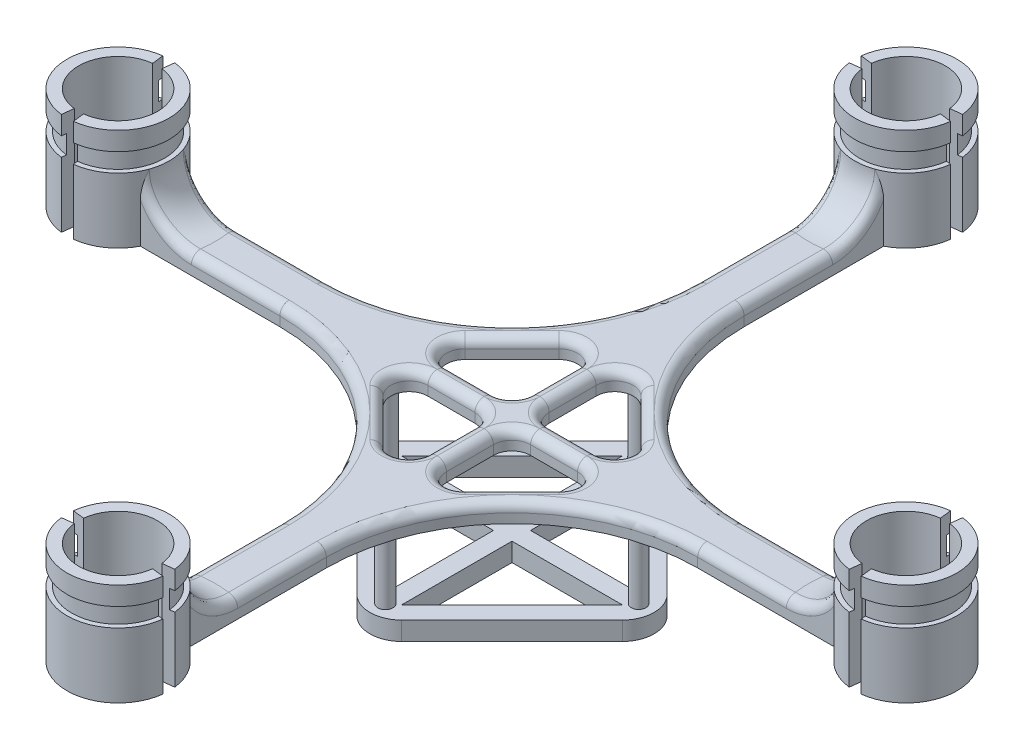
from build123d import *

# Parameters (mm, degrees)
SKETCH1_W           = 5
SKETCH1_H           = 5
BOSS_EXTRUDE1_DEPTH = 2
BOSS_EXTRUDE2_DEPTH = 11
CUT_EXTRUDE1_START  = 7
CUT_EXTRUDE1_DEPTH  = 2
FILLET1_R           = 20
CUT_EXTRUDE2_REACH  = 70.373
FILLET2_R           = 2
FILLET6_R           = 5
FILLET5_R           = 1
SKETCH3_R           = 0.81208947
SKETCH3_R_2         = 1
SKETCH3_R_3         = 0.827650628
SKETCH3_R_4         = 0.78618974
BOSS_EXTRUDE3_DEPTH = 1
SKETCH3_4_R         = 0.78618974
SKETCH3_4_R_2       = 0.827650628
SKETCH3_4_R_3       = 1
SKETCH3_4_R_4       = 0.81208947
BOSS_EXTRUDE4_DEPTH = 10


with BuildPart() as part:
    # Sketch1 → Boss-Extrude1 (new body)
    with BuildSketch(Plane(origin=(0, 0, 0), x_dir=(1, 0, 0), z_dir=(0, 1, 0))):
        with BuildLine():
            ThreePointArc((-4.220485754, 41.926406871), (-3.667100251, 40.278180684), (-2.5, 38.9894751))
            Line((-2.5, 38.9894751), (-2.5, 41.926406871))
            ThreePointArc((-2.5, 41.926406871), (-2.853553391, 42.779960262), (-2, 42.426406871))
            Line((-2, 42.426406871), (2, 42.426406871))
            ThreePointArc((2, 42.426406871), (2.5, 42.926406871), (3, 42.426406871))
            ThreePointArc((3, 42.426406871), (2.853553391, 42.072853481), (2.5, 41.926406871))
            Line((2.5, 41.926406871), (2.5, 38.9894751))
            ThreePointArc((2.5, 38.9894751), (3.667100251, 40.278180684), (4.220485754, 41.926406871))
            ThreePointArc((4.220485754, 41.926406871), (4.242615022, 42.175971705), (4.25, 42.426406871))
            ThreePointArc((4.25, 42.426406871), (4.242615022, 42.676842038), (4.220485754, 42.926406871))
            ThreePointArc((4.220485754, 42.926406871), (0, 46.676406871), (-4.220485754, 42.926406871))
            ThreePointArc((-4.220485754, 42.926406871), (-4.25, 42.426406871), (-4.220485754, 41.926406871))
        make_face()
        with BuildLine():
            Line((-2.5, 41.926406871), (-2.5, 38.9894751))
            ThreePointArc((-2.5, 38.9894751), (0, 38.176406871), (2.5, 38.9894751))
            Line((2.5, 38.9894751), (2.5, 41.926406871))
            ThreePointArc((2.5, 41.926406871), (2.146446609, 42.072853481), (2, 42.426406871))
            Line((2, 42.426406871), (-2, 42.426406871))
            ThreePointArc((-2, 42.426406871), (-2.146446609, 42.072853481), (-2.5, 41.926406871))
        make_face()
        with BuildLine():
            ThreePointArc((4.965277358, 43.014642165), (0, 47.426406871), (-4.965277358, 43.014642165))
            Line((-4.965277358, 43.014642165), (-4.220485754, 42.926406871))
            ThreePointArc((-4.220485754, 42.926406871), (0, 46.676406871), (4.220485754, 42.926406871))
            Line((4.220485754, 42.926406871), (4.965277358, 43.014642165))
        make_face()
        with BuildLine():
            ThreePointArc((5.461805093, 43.073465695), (0, 47.926406871), (-5.461805093, 43.073465695))
            Line((-5.461805093, 43.073465695), (-4.965277358, 43.014642165))
            ThreePointArc((-4.965277358, 43.014642165), (0, 47.426406871), (4.965277358, 43.014642165))
            Line((4.965277358, 43.014642165), (5.461805093, 43.073465695))
        make_face()
        with BuildLine():
            ThreePointArc((-4.965277358, 41.838171577), (-4.175288005, 39.675594251), (-2.5, 38.096279852))
            Line((-2.5, 38.096279852), (-2.5, 38.9894751))
            ThreePointArc((-2.5, 38.9894751), (-3.667100251, 40.278180684), (-4.220485754, 41.926406871))
            Line((-4.220485754, 41.926406871), (-4.965277358, 41.838171577))
        make_face()
        with BuildLine():
            ThreePointArc((-5.461805093, 41.779348048), (-4.513013673, 39.282729473), (-2.5, 37.527427386))
            Line((-2.5, 37.527427386), (-2.5, 38.096279852))
            ThreePointArc((-2.5, 38.096279852), (-4.175288005, 39.675594251), (-4.965277358, 41.838171577))
            Line((-4.965277358, 41.838171577), (-5.461805093, 41.779348048))
        make_face()
        with BuildLine():
            Line((-2.5, 38.9894751), (-2.5, 38.096279852))
            ThreePointArc((-2.5, 38.096279852), (0, 37.426406871), (2.5, 38.096279852))
            Line((2.5, 38.096279852), (2.5, 38.9894751))
            ThreePointArc((2.5, 38.9894751), (0, 38.176406871), (-2.5, 38.9894751))
        make_face()
        with BuildLine():
            Line((-2.5, 37.527427386), (-2.5, 2.5))
            Line((-2.5, 2.5), (2.5, 2.5))
            Line((2.5, 2.5), (2.5, 37.527427386))
            ThreePointArc((2.5, 37.527427386), (0, 36.926406871), (-2.5, 37.527427386))
        make_face()
        with BuildLine():
            Line((2.5, 38.9894751), (2.5, 38.096279852))
            ThreePointArc((2.5, 38.096279852), (4.175288005, 39.675594251), (4.965277358, 41.838171577))
            Line((4.965277358, 41.838171577), (4.220485754, 41.926406871))
            ThreePointArc((4.220485754, 41.926406871), (3.667100251, 40.278180684), (2.5, 38.9894751))
        make_face()
        with BuildLine():
            Line((2.5, 38.096279852), (2.5, 37.527427386))
            ThreePointArc((2.5, 37.527427386), (4.513013673, 39.282729473), (5.461805093, 41.779348048))
            Line((5.461805093, 41.779348048), (4.965277358, 41.838171577))
            ThreePointArc((4.965277358, 41.838171577), (4.175288005, 39.675594251), (2.5, 38.096279852))
        make_face()
        with BuildLine():
            Line((-2.5, 38.096279852), (-2.5, 37.527427386))
            ThreePointArc((-2.5, 37.527427386), (0, 36.926406871), (2.5, 37.527427386))
            Line((2.5, 37.527427386), (2.5, 38.096279852))
            ThreePointArc((2.5, 38.096279852), (0, 37.426406871), (-2.5, 38.096279852))
        make_face()
        with BuildLine():
            Line((2.5, 2.5), (2.5, -2.5))
            Line((2.5, -2.5), (37.527427386, -2.5))
            ThreePointArc((37.527427386, -2.5), (36.926406871, 0), (37.527427386, 2.5))
            Line((37.527427386, 2.5), (2.5, 2.5))
        make_face()
        with BuildLine():
            ThreePointArc((38.9894751, 2.5), (38.176406871, 0), (38.9894751, -2.5))
            Line((38.9894751, -2.5), (41.926406871, -2.5))
            ThreePointArc((41.926406871, -2.5), (42.072853481, -2.146446609), (42.426406871, -2))
            Line((42.426406871, -2), (42.426406871, 2))
            ThreePointArc((42.426406871, 2), (42.072853481, 2.146446609), (41.926406871, 2.5))
            Line((41.926406871, 2.5), (38.9894751, 2.5))
        make_face()
        with BuildLine():
            Line((41.926406871, -2.5), (38.9894751, -2.5))
            ThreePointArc((38.9894751, -2.5), (40.278180684, -3.667100251), (41.926406871, -4.220485754))
            ThreePointArc((41.926406871, -4.220485754), (42.426406871, -4.25), (42.926406871, -4.220485754))
            ThreePointArc((42.926406871, -4.220485754), (45.603473128, -2.822897448), (46.676406871, 0))
            ThreePointArc((46.676406871, 0), (45.603473128, 2.822897448), (42.926406871, 4.220485754))
            ThreePointArc((42.926406871, 4.220485754), (42.426406871, 4.25), (41.926406871, 4.220485754))
            ThreePointArc((41.926406871, 4.220485754), (40.278180684, 3.667100251), (38.9894751, 2.5))
            Line((38.9894751, 2.5), (41.926406871, 2.5))
            ThreePointArc((41.926406871, 2.5), (42.426406871, 3), (42.926406871, 2.5))
            ThreePointArc((42.926406871, 2.5), (42.779960262, 2.146446609), (42.426406871, 2))
            Line((42.426406871, 2), (42.426406871, -2))
            ThreePointArc((42.426406871, -2), (42.779960262, -2.146446609), (42.926406871, -2.5))
            ThreePointArc((42.926406871, -2.5), (42.426406871, -3), (41.926406871, -2.5))
        make_face()
        with BuildLine():
            Line((42.926406871, -4.220485754), (43.014642165, -4.965277358))
            ThreePointArc((43.014642165, -4.965277358), (46.164131879, -3.321055821), (47.426406871, 0))
            ThreePointArc((47.426406871, 0), (46.164131879, 3.321055821), (43.014642165, 4.965277358))
            Line((43.014642165, 4.965277358), (42.926406871, 4.220485754))
            ThreePointArc((42.926406871, 4.220485754), (45.603473128, 2.822897448), (46.676406871, 0))
            ThreePointArc((46.676406871, 0), (45.603473128, -2.822897448), (42.926406871, -4.220485754))
        make_face()
        with BuildLine():
            Line((43.014642165, -4.965277358), (43.073465695, -5.461805093))
            ThreePointArc((43.073465695, -5.461805093), (46.53790438, -3.653161403), (47.926406871, 0))
            ThreePointArc((47.926406871, 0), (46.53790438, 3.653161403), (43.073465695, 5.461805093))
            Line((43.073465695, 5.461805093), (43.014642165, 4.965277358))
            ThreePointArc((43.014642165, 4.965277358), (46.164131879, 3.321055821), (47.426406871, 0))
            ThreePointArc((47.426406871, 0), (46.164131879, -3.321055821), (43.014642165, -4.965277358))
        make_face()
        with BuildLine():
            Line((38.9894751, -2.5), (38.096279852, -2.5))
            ThreePointArc((38.096279852, -2.5), (39.675594251, -4.175288005), (41.838171577, -4.965277358))
            Line((41.838171577, -4.965277358), (41.926406871, -4.220485754))
            ThreePointArc((41.926406871, -4.220485754), (40.278180684, -3.667100251), (38.9894751, -2.5))
        make_face()
        with BuildLine():
            Line((38.096279852, -2.5), (37.527427386, -2.5))
            ThreePointArc((37.527427386, -2.5), (39.282729473, -4.513013673), (41.779348048, -5.461805093))
            Line((41.779348048, -5.461805093), (41.838171577, -4.965277358))
            ThreePointArc((41.838171577, -4.965277358), (39.675594251, -4.175288005), (38.096279852, -2.5))
        make_face()
        with BuildLine():
            ThreePointArc((38.096279852, 2.5), (37.426406871, 0), (38.096279852, -2.5))
            Line((38.096279852, -2.5), (38.9894751, -2.5))
            ThreePointArc((38.9894751, -2.5), (38.176406871, 0), (38.9894751, 2.5))
            Line((38.9894751, 2.5), (38.096279852, 2.5))
        make_face()
        with BuildLine():
            ThreePointArc((37.527427386, 2.5), (36.926406871, 0), (37.527427386, -2.5))
            Line((37.527427386, -2.5), (38.096279852, -2.5))
            ThreePointArc((38.096279852, -2.5), (37.426406871, 0), (38.096279852, 2.5))
            Line((38.096279852, 2.5), (37.527427386, 2.5))
        make_face()
        with BuildLine():
            ThreePointArc((41.838171577, 4.965277358), (39.675594251, 4.175288005), (38.096279852, 2.5))
            Line((38.096279852, 2.5), (38.9894751, 2.5))
            ThreePointArc((38.9894751, 2.5), (40.278180684, 3.667100251), (41.926406871, 4.220485754))
            Line((41.926406871, 4.220485754), (41.838171577, 4.965277358))
        make_face()
        with BuildLine():
            ThreePointArc((41.779348048, 5.461805093), (39.282729473, 4.513013673), (37.527427386, 2.5))
            Line((37.527427386, 2.5), (38.096279852, 2.5))
            ThreePointArc((38.096279852, 2.5), (39.675594251, 4.175288005), (41.838171577, 4.965277358))
            Line((41.838171577, 4.965277358), (41.779348048, 5.461805093))
        make_face()
        with BuildLine():
            Line((2.5, -2.5), (-2.5, -2.5))
            Line((-2.5, -2.5), (-2.5, -37.527427386))
            ThreePointArc((-2.5, -37.527427386), (0, -36.926406871), (2.5, -37.527427386))
            Line((2.5, -37.527427386), (2.5, -2.5))
        make_face()
        with BuildLine():
            ThreePointArc((2.5, -38.9894751), (0, -38.176406871), (-2.5, -38.9894751))
            Line((-2.5, -38.9894751), (-2.5, -41.926406871))
            ThreePointArc((-2.5, -41.926406871), (-2.146446609, -42.072853481), (-2, -42.426406871))
            Line((-2, -42.426406871), (2, -42.426406871))
            ThreePointArc((2, -42.426406871), (2.146446609, -42.072853481), (2.5, -41.926406871))
            Line((2.5, -41.926406871), (2.5, -38.9894751))
        make_face()
        with BuildLine():
            Line((-2.5, -41.926406871), (-2.5, -38.9894751))
            ThreePointArc((-2.5, -38.9894751), (-3.667100251, -40.278180684), (-4.220485754, -41.926406871))
            ThreePointArc((-4.220485754, -41.926406871), (-4.25, -42.426406871), (-4.220485754, -42.926406871))
            ThreePointArc((-4.220485754, -42.926406871), (0, -46.676406871), (4.220485754, -42.926406871))
            ThreePointArc((4.220485754, -42.926406871), (4.242615022, -42.676842038), (4.25, -42.426406871))
            ThreePointArc((4.25, -42.426406871), (4.242615022, -42.175971705), (4.220485754, -41.926406871))
            ThreePointArc((4.220485754, -41.926406871), (3.667100251, -40.278180684), (2.5, -38.9894751))
            Line((2.5, -38.9894751), (2.5, -41.926406871))
            ThreePointArc((2.5, -41.926406871), (2.853553391, -42.072853481), (3, -42.426406871))
            ThreePointArc((3, -42.426406871), (2.5, -42.926406871), (2, -42.426406871))
            Line((2, -42.426406871), (-2, -42.426406871))
            ThreePointArc((-2, -42.426406871), (-2.853553391, -42.779960262), (-2.5, -41.926406871))
        make_face()
        with BuildLine():
            Line((-4.220485754, -42.926406871), (-4.965277358, -43.014642165))
            ThreePointArc((-4.965277358, -43.014642165), (0, -47.426406871), (4.965277358, -43.014642165))
            Line((4.965277358, -43.014642165), (4.220485754, -42.926406871))
            ThreePointArc((4.220485754, -42.926406871), (0, -46.676406871), (-4.220485754, -42.926406871))
        make_face()
        with BuildLine():
            Line((-4.965277358, -43.014642165), (-5.461805093, -43.073465695))
            ThreePointArc((-5.461805093, -43.073465695), (0, -47.926406871), (5.461805093, -43.073465695))
            Line((5.461805093, -43.073465695), (4.965277358, -43.014642165))
            ThreePointArc((4.965277358, -43.014642165), (0, -47.426406871), (-4.965277358, -43.014642165))
        make_face()
        with BuildLine():
            Line((-2.5, -38.9894751), (-2.5, -38.096279852))
            ThreePointArc((-2.5, -38.096279852), (-4.175288005, -39.675594251), (-4.965277358, -41.838171577))
            Line((-4.965277358, -41.838171577), (-4.220485754, -41.926406871))
            ThreePointArc((-4.220485754, -41.926406871), (-3.667100251, -40.278180684), (-2.5, -38.9894751))
        make_face()
        with BuildLine():
            Line((-2.5, -38.096279852), (-2.5, -37.527427386))
            ThreePointArc((-2.5, -37.527427386), (-4.513013673, -39.282729473), (-5.461805093, -41.779348048))
            Line((-5.461805093, -41.779348048), (-4.965277358, -41.838171577))
            ThreePointArc((-4.965277358, -41.838171577), (-4.175288005, -39.675594251), (-2.5, -38.096279852))
        make_face()
        with BuildLine():
            ThreePointArc((2.5, -38.096279852), (0, -37.426406871), (-2.5, -38.096279852))
            Line((-2.5, -38.096279852), (-2.5, -38.9894751))
            ThreePointArc((-2.5, -38.9894751), (0, -38.176406871), (2.5, -38.9894751))
            Line((2.5, -38.9894751), (2.5, -38.096279852))
        make_face()
        with BuildLine():
            ThreePointArc((4.965277358, -41.838171577), (4.175288005, -39.675594251), (2.5, -38.096279852))
            Line((2.5, -38.096279852), (2.5, -38.9894751))
            ThreePointArc((2.5, -38.9894751), (3.667100251, -40.278180684), (4.220485754, -41.926406871))
            Line((4.220485754, -41.926406871), (4.965277358, -41.838171577))
        make_face()
        with BuildLine():
            ThreePointArc((5.461805093, -41.779348048), (4.513013673, -39.282729473), (2.5, -37.527427386))
            Line((2.5, -37.527427386), (2.5, -38.096279852))
            ThreePointArc((2.5, -38.096279852), (4.175288005, -39.675594251), (4.965277358, -41.838171577))
            Line((4.965277358, -41.838171577), (5.461805093, -41.779348048))
        make_face()
        with BuildLine():
            ThreePointArc((2.5, -37.527427386), (0, -36.926406871), (-2.5, -37.527427386))
            Line((-2.5, -37.527427386), (-2.5, -38.096279852))
            ThreePointArc((-2.5, -38.096279852), (0, -37.426406871), (2.5, -38.096279852))
            Line((2.5, -38.096279852), (2.5, -37.527427386))
        make_face()
        with BuildLine():
            ThreePointArc((-36.926406871, 0), (-37.07877248, -1.285615189), (-37.527427386, -2.5))
            Line((-37.527427386, -2.5), (-2.5, -2.5))
            Line((-2.5, -2.5), (-2.5, 2.5))
            Line((-2.5, 2.5), (-37.527427386, 2.5))
            ThreePointArc((-37.527427386, 2.5), (-37.07877248, 1.285615189), (-36.926406871, 0))
        make_face()
        with BuildLine():
            ThreePointArc((-42.926406871, 4.220485754), (-46.676406871, 0), (-42.926406871, -4.220485754))
            ThreePointArc((-42.926406871, -4.220485754), (-42.426406871, -4.25), (-41.926406871, -4.220485754))
            ThreePointArc((-41.926406871, -4.220485754), (-40.278180684, -3.667100251), (-38.9894751, -2.5))
            Line((-38.9894751, -2.5), (-41.926406871, -2.5))
            ThreePointArc((-41.926406871, -2.5), (-42.779960262, -2.853553391), (-42.426406871, -2))
            Line((-42.426406871, -2), (-42.426406871, 2))
            ThreePointArc((-42.426406871, 2), (-42.779960262, 2.853553391), (-41.926406871, 2.5))
            Line((-41.926406871, 2.5), (-38.9894751, 2.5))
            ThreePointArc((-38.9894751, 2.5), (-40.278180684, 3.667100251), (-41.926406871, 4.220485754))
            ThreePointArc((-41.926406871, 4.220485754), (-42.426406871, 4.25), (-42.926406871, 4.220485754))
        make_face()
        with BuildLine():
            Line((-41.926406871, -2.5), (-38.9894751, -2.5))
            ThreePointArc((-38.9894751, -2.5), (-38.384782196, -1.314446646), (-38.176406871, 0))
            ThreePointArc((-38.176406871, 0), (-38.384782196, 1.314446646), (-38.9894751, 2.5))
            Line((-38.9894751, 2.5), (-41.926406871, 2.5))
            ThreePointArc((-41.926406871, 2.5), (-42.072853481, 2.146446609), (-42.426406871, 2))
            Line((-42.426406871, 2), (-42.426406871, -2))
            ThreePointArc((-42.426406871, -2), (-42.072853481, -2.146446609), (-41.926406871, -2.5))
        make_face()
        with BuildLine():
            Line((-43.014642165, -4.965277358), (-42.926406871, -4.220485754))
            ThreePointArc((-42.926406871, -4.220485754), (-46.676406871, 0), (-42.926406871, 4.220485754))
            Line((-42.926406871, 4.220485754), (-43.014642165, 4.965277358))
            ThreePointArc((-43.014642165, 4.965277358), (-47.426406871, 0), (-43.014642165, -4.965277358))
        make_face()
        with BuildLine():
            Line((-43.073465695, -5.461805093), (-43.014642165, -4.965277358))
            ThreePointArc((-43.014642165, -4.965277358), (-47.426406871, 0), (-43.014642165, 4.965277358))
            Line((-43.014642165, 4.965277358), (-43.073465695, 5.461805093))
            ThreePointArc((-43.073465695, 5.461805093), (-47.926406871, 0), (-43.073465695, -5.461805093))
        make_face()
        with BuildLine():
            Line((-41.838171577, 4.965277358), (-41.926406871, 4.220485754))
            ThreePointArc((-41.926406871, 4.220485754), (-40.278180684, 3.667100251), (-38.9894751, 2.5))
            Line((-38.9894751, 2.5), (-38.096279852, 2.5))
            ThreePointArc((-38.096279852, 2.5), (-39.675594251, 4.175288005), (-41.838171577, 4.965277358))
        make_face()
        with BuildLine():
            Line((-41.779348048, 5.461805093), (-41.838171577, 4.965277358))
            ThreePointArc((-41.838171577, 4.965277358), (-39.675594251, 4.175288005), (-38.096279852, 2.5))
            Line((-38.096279852, 2.5), (-37.527427386, 2.5))
            ThreePointArc((-37.527427386, 2.5), (-39.282729473, 4.513013673), (-41.779348048, 5.461805093))
        make_face()
        with BuildLine():
            ThreePointArc((-37.426406871, 0), (-37.59677774, -1.294095226), (-38.096279852, -2.5))
            Line((-38.096279852, -2.5), (-37.527427386, -2.5))
            ThreePointArc((-37.527427386, -2.5), (-37.07877248, -1.285615189), (-36.926406871, 0))
            ThreePointArc((-36.926406871, 0), (-37.07877248, 1.285615189), (-37.527427386, 2.5))
            Line((-37.527427386, 2.5), (-38.096279852, 2.5))
            ThreePointArc((-38.096279852, 2.5), (-37.59677774, 1.294095226), (-37.426406871, 0))
        make_face()
        with BuildLine():
            ThreePointArc((-38.096279852, -2.5), (-39.675594251, -4.175288005), (-41.838171577, -4.965277358))
            Line((-41.838171577, -4.965277358), (-41.779348048, -5.461805093))
            ThreePointArc((-41.779348048, -5.461805093), (-39.282729473, -4.513013673), (-37.527427386, -2.5))
            Line((-37.527427386, -2.5), (-38.096279852, -2.5))
        make_face()
        with BuildLine():
            ThreePointArc((-38.9894751, -2.5), (-40.278180684, -3.667100251), (-41.926406871, -4.220485754))
            Line((-41.926406871, -4.220485754), (-41.838171577, -4.965277358))
            ThreePointArc((-41.838171577, -4.965277358), (-39.675594251, -4.175288005), (-38.096279852, -2.5))
            Line((-38.096279852, -2.5), (-38.9894751, -2.5))
        make_face()
        with BuildLine():
            ThreePointArc((-38.176406871, 0), (-38.384782196, -1.314446646), (-38.9894751, -2.5))
            Line((-38.9894751, -2.5), (-38.096279852, -2.5))
            ThreePointArc((-38.096279852, -2.5), (-37.59677774, -1.294095226), (-37.426406871, 0))
            ThreePointArc((-37.426406871, 0), (-37.59677774, 1.294095226), (-38.096279852, 2.5))
            Line((-38.096279852, 2.5), (-38.9894751, 2.5))
            ThreePointArc((-38.9894751, 2.5), (-38.384782196, 1.314446646), (-38.176406871, 0))
        make_face()
        Rectangle(SKETCH1_W, SKETCH1_H)
    extrude(amount=BOSS_EXTRUDE1_DEPTH)

    # Sketch1<4> → Boss-Extrude2 (add)
    with BuildSketch(Plane(origin=(0, 0, 0), x_dir=(1, 0, 0), z_dir=(0, 1, 0))):
        with BuildLine():
            ThreePointArc((-42.926406871, -4.220485754), (-46.676406871, 0), (-42.926406871, 4.220485754))
            Line((-42.926406871, 4.220485754), (-43.073465695, 5.461805093))
            ThreePointArc((-43.073465695, 5.461805093), (-47.926406871, 0), (-43.073465695, -5.461805093))
            Line((-43.073465695, -5.461805093), (-42.926406871, -4.220485754))
        make_face()
        with BuildLine():
            Line((-41.926406871, -4.220485754), (-41.779348048, -5.461805093))
            ThreePointArc((-41.779348048, -5.461805093), (-36.926406871, 0), (-41.779348048, 5.461805093))
            Line((-41.779348048, 5.461805093), (-41.926406871, 4.220485754))
            ThreePointArc((-41.926406871, 4.220485754), (-38.176406871, 0), (-41.926406871, -4.220485754))
        make_face()
        with BuildLine():
            Line((-5.461805093, -41.779348048), (-4.220485754, -41.926406871))
            ThreePointArc((-4.220485754, -41.926406871), (0, -38.176406871), (4.220485754, -41.926406871))
            Line((4.220485754, -41.926406871), (5.461805093, -41.779348048))
            ThreePointArc((5.461805093, -41.779348048), (0, -36.926406871), (-5.461805093, -41.779348048))
        make_face()
        with BuildLine():
            ThreePointArc((-5.461805093, 41.779348048), (0, 36.926406871), (5.461805093, 41.779348048))
            Line((5.461805093, 41.779348048), (4.220485754, 41.926406871))
            ThreePointArc((4.220485754, 41.926406871), (0, 38.176406871), (-4.220485754, 41.926406871))
            Line((-4.220485754, 41.926406871), (-5.461805093, 41.779348048))
        make_face()
        with BuildLine():
            Line((41.779348048, -5.461805093), (41.926406871, -4.220485754))
            ThreePointArc((41.926406871, -4.220485754), (38.176406871, 0), (41.926406871, 4.220485754))
            Line((41.926406871, 4.220485754), (41.779348048, 5.461805093))
            ThreePointArc((41.779348048, 5.461805093), (36.926406871, 0), (41.779348048, -5.461805093))
        make_face()
        with BuildLine():
            ThreePointArc((-5.461805093, -43.073465695), (0, -47.926406871), (5.461805093, -43.073465695))
            Line((5.461805093, -43.073465695), (4.220485754, -42.926406871))
            ThreePointArc((4.220485754, -42.926406871), (0, -46.676406871), (-4.220485754, -42.926406871))
            Line((-4.220485754, -42.926406871), (-5.461805093, -43.073465695))
        make_face()
        with BuildLine():
            ThreePointArc((5.461805093, 43.073465695), (0, 47.926406871), (-5.461805093, 43.073465695))
            Line((-5.461805093, 43.073465695), (-4.220485754, 42.926406871))
            ThreePointArc((-4.220485754, 42.926406871), (0, 46.676406871), (4.220485754, 42.926406871))
            Line((4.220485754, 42.926406871), (5.461805093, 43.073465695))
        make_face()
        with BuildLine():
            ThreePointArc((43.073465695, -5.461805093), (47.926406871, 0), (43.073465695, 5.461805093))
            Line((43.073465695, 5.461805093), (42.926406871, 4.220485754))
            ThreePointArc((42.926406871, 4.220485754), (46.676406871, 0), (42.926406871, -4.220485754))
            Line((42.926406871, -4.220485754), (43.073465695, -5.461805093))
        make_face()
    extrude(amount=BOSS_EXTRUDE2_DEPTH)

    # Sketch1<6> → Cut-Extrude1 (cut)
    with BuildSketch(Plane(origin=(0, 0, 0), x_dir=(1, 0, 0), z_dir=(0, 1, 0)).offset(CUT_EXTRUDE1_START)):
        with BuildLine():
            Line((-43.073465695, -5.461805093), (-43.014642165, -4.965277358))
            ThreePointArc((-43.014642165, -4.965277358), (-47.426406871, 0), (-43.014642165, 4.965277358))
            Line((-43.014642165, 4.965277358), (-43.073465695, 5.461805093))
            ThreePointArc((-43.073465695, 5.461805093), (-47.926406871, 0), (-43.073465695, -5.461805093))
        make_face()
        with BuildLine():
            Line((-41.838171577, -4.965277358), (-41.779348048, -5.461805093))
            ThreePointArc((-41.779348048, -5.461805093), (-36.926406871, 0), (-41.779348048, 5.461805093))
            Line((-41.779348048, 5.461805093), (-41.838171577, 4.965277358))
            ThreePointArc((-41.838171577, 4.965277358), (-37.426406871, 0), (-41.838171577, -4.965277358))
        make_face()
        with BuildLine():
            Line((-5.461805093, -41.779348048), (-4.965277358, -41.838171577))
            ThreePointArc((-4.965277358, -41.838171577), (0, -37.426406871), (4.965277358, -41.838171577))
            Line((4.965277358, -41.838171577), (5.461805093, -41.779348048))
            ThreePointArc((5.461805093, -41.779348048), (0, -36.926406871), (-5.461805093, -41.779348048))
        make_face()
        with BuildLine():
            ThreePointArc((-5.461805093, 41.779348048), (0, 36.926406871), (5.461805093, 41.779348048))
            Line((5.461805093, 41.779348048), (4.965277358, 41.838171577))
            ThreePointArc((4.965277358, 41.838171577), (0, 37.426406871), (-4.965277358, 41.838171577))
            Line((-4.965277358, 41.838171577), (-5.461805093, 41.779348048))
        make_face()
        with BuildLine():
            Line((41.779348048, -5.461805093), (41.838171577, -4.965277358))
            ThreePointArc((41.838171577, -4.965277358), (37.426406871, 0), (41.838171577, 4.965277358))
            Line((41.838171577, 4.965277358), (41.779348048, 5.461805093))
            ThreePointArc((41.779348048, 5.461805093), (36.926406871, 0), (41.779348048, -5.461805093))
        make_face()
        with BuildLine():
            Line((-4.965277358, -43.014642165), (-5.461805093, -43.073465695))
            ThreePointArc((-5.461805093, -43.073465695), (0, -47.926406871), (5.461805093, -43.073465695))
            Line((5.461805093, -43.073465695), (4.965277358, -43.014642165))
            ThreePointArc((4.965277358, -43.014642165), (0, -47.426406871), (-4.965277358, -43.014642165))
        make_face()
        with BuildLine():
            ThreePointArc((5.461805093, 43.073465695), (0, 47.926406871), (-5.461805093, 43.073465695))
            Line((-5.461805093, 43.073465695), (-4.965277358, 43.014642165))
            ThreePointArc((-4.965277358, 43.014642165), (0, 47.426406871), (4.965277358, 43.014642165))
            Line((4.965277358, 43.014642165), (5.461805093, 43.073465695))
        make_face()
        with BuildLine():
            Line((43.014642165, -4.965277358), (43.073465695, -5.461805093))
            ThreePointArc((43.073465695, -5.461805093), (47.926406871, 0), (43.073465695, 5.461805093))
            Line((43.073465695, 5.461805093), (43.014642165, 4.965277358))
            ThreePointArc((43.014642165, 4.965277358), (47.426406871, 0), (43.014642165, -4.965277358))
        make_face()
    extrude(amount=CUT_EXTRUDE1_DEPTH, mode=Mode.SUBTRACT)

    # Fillet1
    fillet1_edges = [part.edges().sort_by_distance(p)[0] for p in [
        (2.5, 1, 2.5),
        (-2.5, 1, 2.5),
        (-2.5, 1, -2.5),
        (2.5, 1, -2.5),
    ]]
    fillet(fillet1_edges, radius=FILLET1_R)

    # Sketch2 → Cut-Extrude2 (cut, up to next)
    with BuildSketch(Plane(origin=(0, 2, 0), x_dir=(1, 0, 0), z_dir=(0, 1, 0)), mode=Mode.PRIVATE) as cut_extrude2_sk1:
        Polygon((-1, -12.887301628), (-12.887301628, -1), (-1, -1), align=None)
    cut_extrude2_tool1 = extrude(cut_extrude2_sk1.sketch, amount=-CUT_EXTRUDE2_REACH, mode=Mode.PRIVATE) & part.part
    # Sketch2 → Cut-Extrude2 (cut, up to next)
    with BuildSketch(Plane(origin=(0, 2, 0), x_dir=(1, 0, 0), z_dir=(0, 1, 0)), mode=Mode.PRIVATE) as cut_extrude2_sk2:
        Polygon((1, -1), (12.887301628, -1), (1, -12.887301628), align=None)
    cut_extrude2_tool2 = extrude(cut_extrude2_sk2.sketch, amount=-CUT_EXTRUDE2_REACH, mode=Mode.PRIVATE) & part.part
    # Sketch2 → Cut-Extrude2 (cut, up to next)
    with BuildSketch(Plane(origin=(0, 2, 0), x_dir=(1, 0, 0), z_dir=(0, 1, 0)), mode=Mode.PRIVATE) as cut_extrude2_sk3:
        Polygon((1, 1), (1, 12.887301628), (12.887301628, 1), align=None)
    cut_extrude2_tool3 = extrude(cut_extrude2_sk3.sketch, amount=-CUT_EXTRUDE2_REACH, mode=Mode.PRIVATE) & part.part
    # Sketch2 → Cut-Extrude2 (cut, up to next)
    with BuildSketch(Plane(origin=(0, 2, 0), x_dir=(1, 0, 0), z_dir=(0, 1, 0)), mode=Mode.PRIVATE) as cut_extrude2_sk4:
        Polygon((-12.887301628, 1), (-1, 1), (-1, 12.887301628), align=None)
    cut_extrude2_tool4 = extrude(cut_extrude2_sk4.sketch, amount=-CUT_EXTRUDE2_REACH, mode=Mode.PRIVATE) & part.part
    add(cut_extrude2_tool1.solids().sort_by_distance((-4.962434, 2, 4.962434))[0], mode=Mode.SUBTRACT)
    add(cut_extrude2_tool2.solids().sort_by_distance((4.962434, 2, 4.962434))[0], mode=Mode.SUBTRACT)
    add(cut_extrude2_tool3.solids().sort_by_distance((4.962434, 2, -4.962434))[0], mode=Mode.SUBTRACT)
    add(cut_extrude2_tool4.solids().sort_by_distance((-4.962434, 2, -4.962434))[0], mode=Mode.SUBTRACT)

    # Fillet2
    fillet2_edges = [part.edges().sort_by_distance(p)[0] for p in [
        (-1, 1, -1),
        (-12.887301628, 1, -1),
        (-1, 1, -12.887301628),
        (1, 1, -1),
        (1, 1, -12.887301628),
        (12.887301628, 1, -1),
        (1, 1, 1),
        (12.887301628, 1, 1),
        (1, 1, 12.887301628),
        (-1, 1, 12.887301628),
        (-12.887301628, 1, 1),
        (-1, 1, 1),
    ]]
    fillet(fillet2_edges, radius=FILLET2_R)

    # Fillet6
    fillet6_edges = [part.edges().sort_by_distance(p)[0] for p in [
        (0, 2, 36.926406871),
        (36.926406871, 2, 0),
        (0, 2, -36.926406871),
        (-36.926406871, 2, 0),
    ]]
    fillet(fillet6_edges, radius=FILLET6_R - 0.0001)  # a hair under: the kernel refuses the full size

    # Fillet5
    fillet5_edges = [part.edges().sort_by_distance(p)[0] for p in [
        (-27.364235403, 2, 2.5),
        (2.5, 2, -27.364235403),
        (-2.5, 2, -27.364235403),
        (-27.364235403, 2, -2.5),
        (-35.897816401, 3.438183539, 2.5),
        (-35.897816401, 3.438183539, -2.5),
        (-2.5, 3.438183539, -35.897816401),
        (2.5, 3.438183539, -35.897816401),
        (2.5, 3.438183539, 35.897816401),
        (-2.5, 3.438183539, 35.897816401),
        (35.897816401, 3.438183539, -2.5),
        (35.897816401, 3.438183539, 2.5),
        (-2.5, 2, 27.364235403),
        (27.364235403, 2, 2.5),
        (2.5, 2, 27.364235403),
        (27.364235403, 2, -2.5),
        (-8.357864376, 2, 8.357864376),
        (8.357864376, 2, 8.357864376),
        (8.357864376, 2, -8.357864376),
        (-8.357864376, 2, -8.357864376),
        (-1, 2, 5.529437252),
        (-6.943650814, 2, 6.943650814),
        (6.943650814, 2, 6.943650814),
        (1, 2, 5.529437252),
        (5.529437252, 2, 1),
        (-5.529437252, 2, 1),
        (-5.529437252, 2, -1),
        (-6.943650814, 2, -6.943650814),
        (6.943650814, 2, -6.943650814),
        (5.529437252, 2, -1),
        (-1, 2, -5.529437252),
        (1, 2, -5.529437252),
        (-2.234633135, 2, 9.906633568),
        (2.234633135, 2, 9.906633568),
        (9.906633568, 2, 2.234633135),
        (-9.906633568, 2, 2.234633135),
        (-9.906633568, 2, -2.234633135),
        (9.906633568, 2, -2.234633135),
        (-2.234633135, 2, -9.906633568),
        (2.234633135, 2, -9.906633568),
        (1.585786438, 2, -1.585786438),
        (-1.585786438, 2, -1.585786438),
        (-1.585786438, 2, 1.585786438),
        (1.585786438, 2, 1.585786438),
    ]]
    fillet(fillet5_edges, radius=FILLET5_R - 0.0001)  # a hair under: the kernel refuses the full size



with BuildPart() as body_2:
    # Sketch3 → Boss-Extrude3 (new, symmetric)
    # profile 1 of 5: a face of its own
    with BuildSketch(Plane(origin=(0, -10, 0), x_dir=(-1, 0, 0), z_dir=(0, -1, 0))):
        with BuildLine():
            Line((-2.414213562, 14.30151519), (-14.30151519, 2.414213562))
            ThreePointArc((-14.30151519, 2.414213562), (-15.30151519, 0), (-14.30151519, -2.414213562))
            Line((-14.30151519, -2.414213562), (-2.414213562, -14.30151519))
            ThreePointArc((-2.414213562, -14.30151519), (0, -15.30151519), (2.414213562, -14.30151519))
            Line((2.414213562, -14.30151519), (14.30151519, -2.414213562))
            ThreePointArc((14.30151519, -2.414213562), (15.30151519, 0), (14.30151519, 2.414213562))
            Line((14.30151519, 2.414213562), (2.414213562, 14.30151519))
            ThreePointArc((2.414213562, 14.30151519), (0, 15.30151519), (-2.414213562, 14.30151519))
        make_face()
        with Locations((0, -13.637301628)):
            Circle(SKETCH3_R, mode=Mode.SUBTRACT)
        with Locations((13.637301628, 0)):
            Circle(SKETCH3_R_2, mode=Mode.SUBTRACT)
        with Locations((0, 13.637301628)):
            Circle(SKETCH3_R_3, mode=Mode.SUBTRACT)
        with Locations((-13.637301628, 0)):
            Circle(SKETCH3_R_4, mode=Mode.SUBTRACT)
        Polygon((-12.887301628, 1), (-1, 1), (-1, 12.887301628), align=None, mode=Mode.SUBTRACT)
        Polygon((1, 1), (12.887301628, 1), (1, 12.887301628), align=None, mode=Mode.SUBTRACT)
        Polygon((-1, -12.887301628), (-1, -1), (-12.887301628, -1), align=None, mode=Mode.SUBTRACT)
        Polygon((1, -1), (1, -12.887301628), (12.887301628, -1), align=None, mode=Mode.SUBTRACT)
    # profile 2 of 5: a face of its own
    with BuildSketch(Plane(origin=(0, -10, 0), x_dir=(-1, 0, 0), z_dir=(0, -1, 0))):
        with Locations((0, 13.637301628)):
            Circle(SKETCH3_R_3)
    # profile 3 of 5: a face of its own
    with BuildSketch(Plane(origin=(0, -10, 0), x_dir=(-1, 0, 0), z_dir=(0, -1, 0))):
        with Locations((-13.637301628, 0)):
            Circle(SKETCH3_R_4)
    # profile 4 of 5: a face of its own
    with BuildSketch(Plane(origin=(0, -10, 0), x_dir=(-1, 0, 0), z_dir=(0, -1, 0))):
        with Locations((13.637301628, 0)):
            Circle(SKETCH3_R_2)
    # profile 5 of 5: a face of its own
    with BuildSketch(Plane(origin=(0, -10, 0), x_dir=(-1, 0, 0), z_dir=(0, -1, 0))):
        with Locations((0, -13.637301628)):
            Circle(SKETCH3_R)
    extrude(amount=BOSS_EXTRUDE3_DEPTH, both=True)


with BuildPart() as part_1:
    add(part.part)

    add(body_2.part)  # Boss-Extrude4 merges body 2
    # Sketch3<4> → Boss-Extrude4 (add)
    with BuildSketch(Plane(origin=(0, -10, 0), x_dir=(-1, 0, 0), z_dir=(0, -1, 0))):
        with Locations(Location((-13.637301628, 0, 0), (0, 0, 90))):
            Circle(SKETCH3_4_R)
        with Locations(Location((0, 13.637301628, 0), (0, 0, 90))):
            Circle(SKETCH3_4_R_2)
        with Locations(Location((13.637301628, 0, 0), (0, 0, 90))):
            Circle(SKETCH3_4_R_3)
        with Locations(Location((0, -13.637301628, 0), (0, 0, 90))):
            Circle(SKETCH3_4_R_4)
    extrude(amount=-BOSS_EXTRUDE4_DEPTH)


solid = part_1.part
